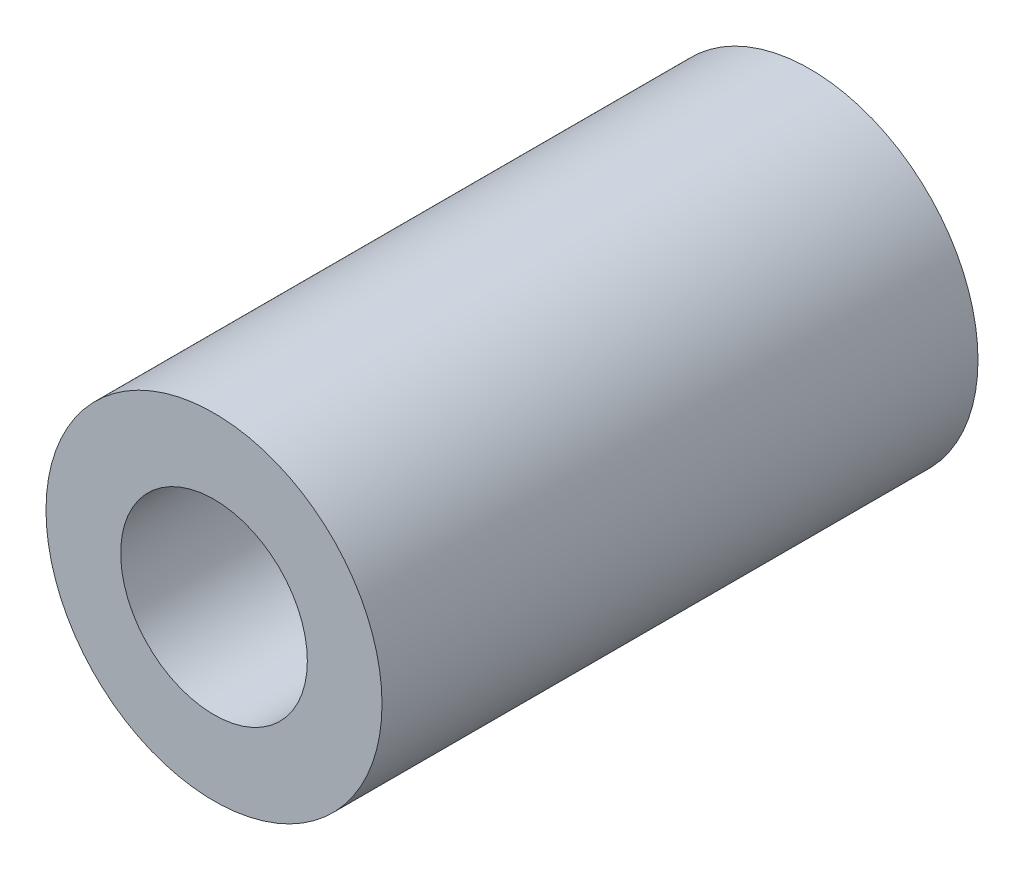
from build123d import *

# Parameters (mm, degrees)
SKETCH1_R      = 4.5
SKETCH1_R_2    = 2.5
EXTRUDE1_DEPTH = 15.963


with BuildPart() as part:
    # Sketch1 → Extrude1 (new body)
    with BuildSketch(Plane.XY):
        Circle(SKETCH1_R)
        Circle(SKETCH1_R_2, mode=Mode.SUBTRACT)
    extrude(amount=EXTRUDE1_DEPTH)


solid = part.part
